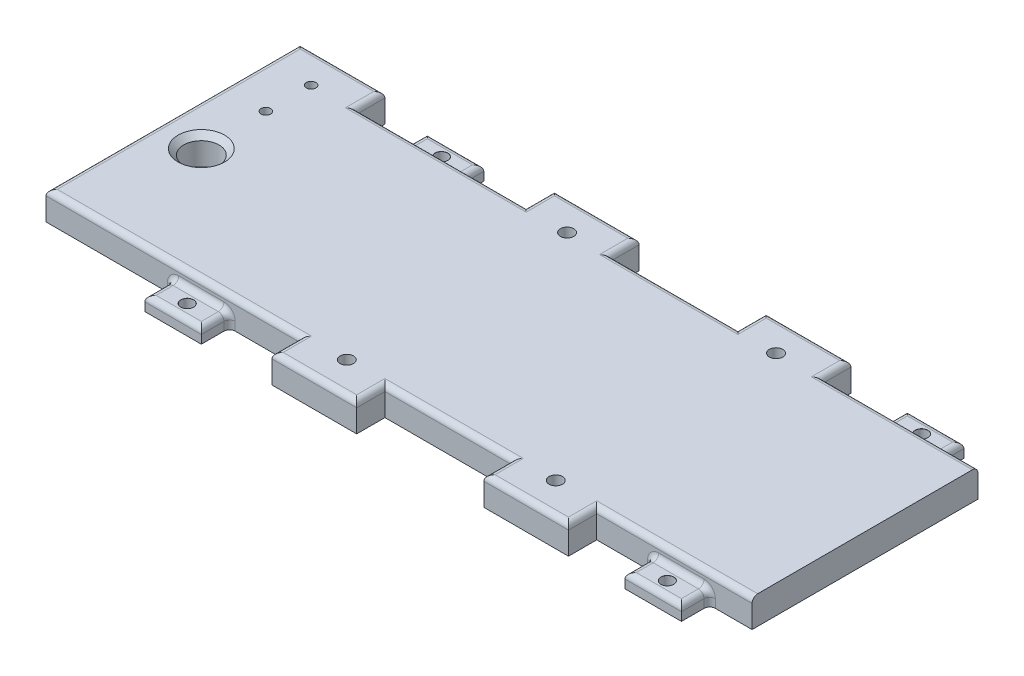
from build123d import *

# Parameters (mm, degrees)
SKETCH1_W                      = 260
SKETCH1_H                      = 100
BOSS_EXTRUDE1_DEPTH            = 10
SKETCH3_W                      = 55
SKETCH3_H                      = 10
SKETCH3_W_2                    = 60
SKETCH3_W_3                    = 45
CUT_EXTRUDE2_DEPTH             = 140.642400438
SKETCH5_W                      = 20
SKETCH5_H                      = 10
BOSS_EXTRUDE2_DEPTH            = 5
FILLET1_R                      = 2
SKETCH2_R                      = 6.25
CUT_EXTRUDE1_DEPTH             = 140.642400438
CHAMFER1_SIZE                  = 2
SKETCH4_R                      = 2.375
CUT_EXTRUDE3_DEPTH             = 6.2
M4_CLEARANCE_HOLE1_D           = 4.5
M4_CLEARANCE_HOLE1_CSINK_D     = 4.55
M4_CLEARANCE_HOLE1_CSINK_ANGLE = 90
M3_CLEARANCE_HOLE1_D           = 3.4
SKETCH13_R                     = 3.5
CUT_EXTRUDE4_DEPTH             = 5


with BuildPart() as part:
    # Sketch1 → Boss-Extrude1 (new body)
    with BuildSketch(Plane(origin=(0, 0, 0), x_dir=(1, 0, 0), z_dir=(0, 1, 0))):
        Rectangle(SKETCH1_W, SKETCH1_H)
    extrude(amount=BOSS_EXTRUDE1_DEPTH)

    # Sketch3 → Cut-Extrude2 (cut, through all)
    with BuildSketch(Plane(origin=(0, 10, 0), x_dir=(1, 0, 0), z_dir=(0, 1, 0))):
        with Locations((102.5, 45)):
            Rectangle(SKETCH3_W, SKETCH3_H)
        with Locations((102.5, -45)):
            Rectangle(SKETCH3_W, SKETCH3_H)
        Polygon((-130, -50), (-30, -50), (-30, -40), (-120, -40), (-120, 50), (-130, 50), (-130, -40), align=None)
        with Locations((-60, 45)):
            Rectangle(SKETCH3_W_2, SKETCH3_H)
        with Locations((22.5, 45)):
            Rectangle(SKETCH3_W_3, SKETCH3_H)
        with Locations((22.5, -45)):
            Rectangle(SKETCH3_W_3, SKETCH3_H)
    extrude(amount=-CUT_EXTRUDE2_DEPTH, mode=Mode.SUBTRACT)

    # Sketch5 → Boss-Extrude2 (add)
    with BuildSketch(Plane.XZ):
        with Locations((-65, 45)):
            Rectangle(SKETCH5_W, SKETCH5_H)
        with Locations((-65, -45)):
            Rectangle(SKETCH5_W, SKETCH5_H)
        with Locations((105, 45)):
            Rectangle(SKETCH5_W, SKETCH5_H)
        with Locations((105, -45)):
            Rectangle(SKETCH5_W, SKETCH5_H)
    extrude(amount=-BOSS_EXTRUDE2_DEPTH)

    # Fillet1
    fillet1_edges = [part.edges().sort_by_distance(p)[0] for p in [
        (-60, 10, -40),
        (-30, 10, -45),
        (-15, 10, -50),
        (60, 10, -50),
        (75, 10, -45),
        (102.5, 10, -40),
        (102.5, 10, 40),
        (75, 10, 45),
        (-30, 10, 45),
        (-75, 10, 40),
        (-90, 10, -45),
        (60, 10, 50),
        (45, 10, 45),
        (22.5, 10, 40),
        (0, 10, 45),
        (-15, 10, 50),
        (0, 10, -45),
        (22.5, 10, -40),
        (45, 10, -45),
        (-120, 10, -5),
        (-105, 10, -50),
        (-75, 2.5, 40),
        (-55, 2.5, 40),
        (95, 2.5, 40),
        (115, 2.5, 40),
        (115, 2.5, -40),
        (95, 2.5, -40),
        (-55, 2.5, -40),
        (-75, 2.5, -40),
        (-65, 5, 40),
        (-55, 5, 45),
        (-65, 5, 50),
        (-75, 5, 45),
        (105, 5, 40),
        (115, 5, 45),
        (105, 5, 50),
        (95, 5, 45),
        (105, 5, -50),
        (115, 5, -45),
        (105, 5, -40),
        (95, 5, -45),
        (-65, 5, -50),
        (-55, 5, -45),
        (-65, 5, -40),
        (-75, 5, -45),
    ]]
    fillet(fillet1_edges, radius=FILLET1_R)

    # Sketch2 → Cut-Extrude1 (cut, through all)
    with BuildSketch(Plane(origin=(0, 10, 0), x_dir=(1, 0, 0), z_dir=(0, 1, 0))):
        with Locations((-105, 0)):
            Circle(SKETCH2_R)
    extrude(amount=-CUT_EXTRUDE1_DEPTH, mode=Mode.SUBTRACT)

    # Chamfer1
    chamfer1_edges = [part.edges().sort_by_distance(p)[0] for p in [
        (-111.25, 10, 0),
    ]]
    chamfer(chamfer1_edges, length=CHAMFER1_SIZE)

    # Sketch4 → Cut-Extrude3 (cut)
    with BuildSketch(Plane(origin=(0, 10, 0), x_dir=(1, 0, 0), z_dir=(0, 1, 0))):
        with Locations((59.5, 39)):
            Circle(SKETCH4_R)
        with Locations((-14.5, 39)):
            Circle(SKETCH4_R)
        with Locations((59.5, -39)):
            Circle(SKETCH4_R)
        with Locations((-14.5, -39)):
            Circle(SKETCH4_R)
    extrude(amount=-CUT_EXTRUDE3_DEPTH, mode=Mode.SUBTRACT)

    # M4 Clearance Hole1 (through all)
    with Locations(Plane(origin=(0, 5, 0), x_dir=(1, 0, 0), z_dir=(0, 1, 0))):
        with Locations((-65, 45), (105, 45), (105, -45), (-65, -45)):
            CounterSinkHole(M4_CLEARANCE_HOLE1_D / 2, M4_CLEARANCE_HOLE1_CSINK_D / 2, counter_sink_angle=M4_CLEARANCE_HOLE1_CSINK_ANGLE)

    # M3 Clearance Hole1 (through all)
    with Locations(Plane(origin=(0, 0, 0), x_dir=(-1, 0, 0), z_dir=(0, -1, 0))):
        with Locations((105, 38.858899), (105, 22.858899)):
            Hole(M3_CLEARANCE_HOLE1_D / 2)

    # Sketch13 → Cut-Extrude4 (cut)
    with BuildSketch(Plane.XZ):
        with Locations((-105, -22.858899)):
            Circle(SKETCH13_R)
        with Locations((-105, -38.858899)):
            Circle(SKETCH13_R)
    extrude(amount=-CUT_EXTRUDE4_DEPTH, mode=Mode.SUBTRACT)


solid = part.part
